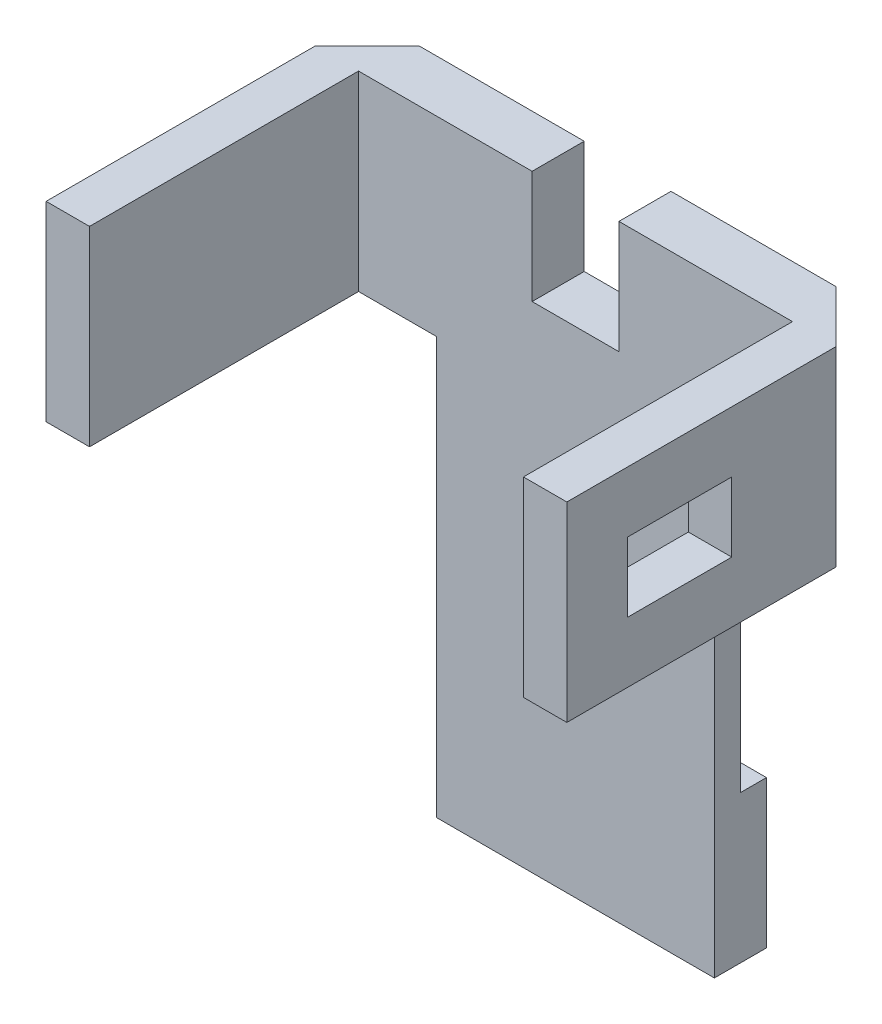
from build123d import *

# Parameters (mm, degrees)
EXTRUDE_1_DEPTH            = 6
SKETCH_2_W                 = 5
SKETCH_2_H                 = 22
EXTRUDE_2_DEPTH            = 31
CHAMFER_1_SIZE             = 6
SKETCH_3_W                 = 12
SKETCH_3_H                 = 8
CUT_EXTRUDE_1_DEPTH        = 57.73623181
SKETCH_4_W                 = 3
SKETCH_4_H                 = 21
CUT_EXTRUDE_2_DEPTH        = 60.110066825
CHAMFER_1_OF_MIRROR_1_SIZE = 6


with BuildPart() as part:
    # Эскиз1 → Бобышка-Вытянуть1 (new body)
    with BuildSketch(Plane.XY):
        Polygon((-15, 22), (-15, -35), (1, -35), (1, 13), (15, 13), (15, 35), (-10, 35), (-10, 22), align=None)
    extrude_1 = extrude(amount=EXTRUDE_1_DEPTH)

    # Эскиз2 → Бобышка-Вытянуть2 (add)
    with BuildSketch(Plane.XY.offset(6)):
        with Locations((12.5, 24)):
            Rectangle(SKETCH_2_W, SKETCH_2_H)
    extrude_2 = extrude(amount=EXTRUDE_2_DEPTH)

    # Фаска1
    chamfer_1_edges = [part.edges().sort_by_distance(p)[0] for p in [
        (15, 24, 0),
    ]]
    chamfer(chamfer_1_edges, length=CHAMFER_1_SIZE)

    # Эскиз3 → Вырез-Вытянуть1 (cut, through all)
    with BuildSketch(Plane.ZY.offset(-10)):
        with Locations((24, 24)):
            Rectangle(SKETCH_3_W, SKETCH_3_H)
    extrude(amount=-CUT_EXTRUDE_1_DEPTH, mode=Mode.SUBTRACT)

    # Эскиз4 → Вырез-Вытянуть2 (cut, through all)
    with BuildSketch(Plane.ZY.offset(15)):
        with Locations((1.5, -7.5)):
            Rectangle(SKETCH_4_W, SKETCH_4_H)
    cut_extrude_2 = extrude(amount=-CUT_EXTRUDE_2_DEPTH, mode=Mode.SUBTRACT)

    # Зеркальное отражение1: Бобышка-Вытянуть1, Бобышка-Вытянуть2, Вырез-Вытянуть2 across plane
    add(extrude_1.mirror(Plane(origin=(-15, 0, 6), x_dir=(0, 0, 1), z_dir=(-1, 0, 0))))
    add(extrude_2.mirror(Plane(origin=(-15, 0, 6), x_dir=(0, 0, 1), z_dir=(-1, 0, 0))))
    add(cut_extrude_2.mirror(Plane(origin=(-15, 0, 6), x_dir=(0, 0, 1), z_dir=(-1, 0, 0))), mode=Mode.SUBTRACT)

    # Фаска1 of Зеркальное отражение1
    chamfer_1_of_mirror_1_edges = [part.edges().sort_by_distance(p)[0] for p in [
        (-45, 24, 0),
    ]]
    chamfer(chamfer_1_of_mirror_1_edges, length=CHAMFER_1_OF_MIRROR_1_SIZE)


solid = part.part
